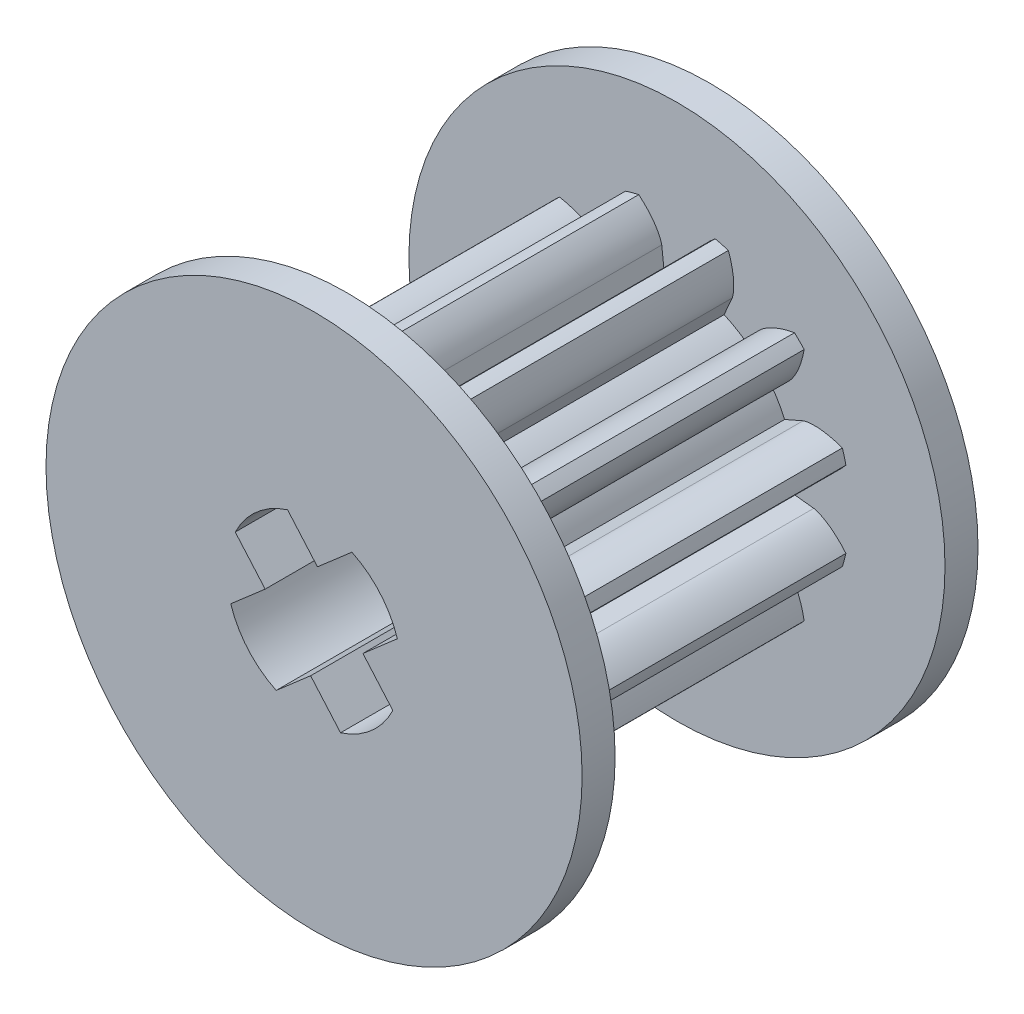
from build123d import *

# Parameters (mm, degrees)
SKETCH1_R               = 5.25
BOSS_EXTRUDE1_DEPTH     = 10
CUT_EXTRUDE3_DEPTH      = 13.454918707
CIRPATTERN1_COUNT       = 12
SKETCH6_R               = 8.125
BOSS_EXTRUDE2_DEPTH     = 1
CUT_EXTRUDE4_DEPTH      = 16.906956128
CUT_EXTRUDE4_DEPTH_BACK = 16.906956128


with BuildPart() as part:
    # Sketch1 → Boss-Extrude1 (new body)
    with BuildSketch(Plane.XY):
        Circle(SKETCH1_R)
    extrude(amount=BOSS_EXTRUDE1_DEPTH)

    # Sketch3 → Cut-Extrude3 (cut, through all)
    with BuildSketch(Plane.XY):
        with BuildLine():
            add(Edge.make_bspline(
                [(0.461546791, 4.146720396), (0.463953922, 4.163714882), (0.472985914, 4.201315534), (0.494149183, 4.266634462), (0.528558847, 4.349970943), (0.562413319, 4.416839281), (0.584280793, 4.45603904), (0.587367865, 4.461501876)],
                knots=[0, 0, 0, 0, 0.040008387, 0.090017613, 0.160030412, 0.250046806, 0.264674884, 0.264674884, 0.264674884, 0.264674884], degree=3))
            add(Edge.make_bspline(
                [(0.587367865, 4.461501876), (0.634900369, 4.545614692), (0.726044104, 4.679105945), (0.914750766, 4.902091874), (1.057206539, 5.036685302), (1.15776547, 5.120749859)],
                knots=[0.264674884, 0.264674884, 0.264674884, 0.264674884, 0.489907489, 0.63993471, 0.945583804, 0.945583804, 0.945583804, 0.945583804], degree=3))
            ThreePointArc((1.15776547, 5.120749859), (0, 5.25), (-1.15776547, 5.120749859))
            add(Edge.make_bspline(
                [(-0.587367865, 4.461501876), (-0.634900369, 4.545614692), (-0.726044104, 4.679105945), (-0.914750766, 4.902091874), (-1.057206539, 5.036685302), (-1.15776547, 5.120749859)],
                knots=[0.264674884, 0.264674884, 0.264674884, 0.264674884, 0.489907489, 0.63993471, 0.945583804, 0.945583804, 0.945583804, 0.945583804], degree=3))
            add(Edge.make_bspline(
                [(-0.461546791, 4.146720396), (-0.463953922, 4.163714882), (-0.472985914, 4.201315534), (-0.494149183, 4.266634462), (-0.528558847, 4.349970943), (-0.562413319, 4.416839281), (-0.584280793, 4.45603904), (-0.587367865, 4.461501876)],
                knots=[0, 0, 0, 0, 0.040008387, 0.090017613, 0.160030412, 0.250046806, 0.264674884, 0.264674884, 0.264674884, 0.264674884], degree=3))
            Line((-0.461546791, 4.146720396), (-0.394087114, 3.540635762))
            ThreePointArc((-0.394087114, 3.540635762), (0, 3.5625), (0.394087114, 3.540635762))
            Line((0.394087114, 3.540635762), (0.461546791, 4.146720396))
        make_face()
    cut_extrude3 = extrude(amount=CUT_EXTRUDE3_DEPTH, mode=Mode.SUBTRACT)

    # CirPattern1: Cut-Extrude3 ×12 about axis
    cirpattern1_axis = Axis((0, 0, 71.213492813), (0, 0, -1))
    for i in range(1, CIRPATTERN1_COUNT):
        add(cut_extrude3.rotate(cirpattern1_axis, i * 360 / CIRPATTERN1_COUNT), mode=Mode.SUBTRACT)

    # Sketch6 → Boss-Extrude2 (add)
    with BuildSketch(Plane.XY.offset(10)):
        Circle(SKETCH6_R)
    boss_extrude2 = extrude(amount=BOSS_EXTRUDE2_DEPTH)

    # Mirror1: Boss-Extrude2 across plane
    add(boss_extrude2.mirror(Plane.XY.offset(5)))

    # Sketch5 → Cut-Extrude4 (cut, two sides: drawn at the far end of the back side and taken through both)
    with BuildSketch(Plane.XY.offset(-CUT_EXTRUDE4_DEPTH_BACK)):
        with BuildLine():
            Line((1.147891735, 2.388481644), (0.103872104, 1.481286801))
            Line((0.103872104, 1.481286801), (-0.80332274, 2.525306432))
            ThreePointArc((-0.80332274, 2.525306432), (-1.738166165, 2.00031957), (-2.388481644, 1.147891735))
            Line((-2.388481644, 1.147891735), (-1.481286801, 0.103872104))
            Line((-1.481286801, 0.103872104), (-2.525306432, -0.80332274))
            ThreePointArc((-2.525306432, -0.80332274), (-2.00031957, -1.738166165), (-1.147891735, -2.388481644))
            Line((-1.147891735, -2.388481644), (-0.103872104, -1.481286801))
            Line((-0.103872104, -1.481286801), (0.80332274, -2.525306432))
            ThreePointArc((0.80332274, -2.525306432), (1.738166165, -2.00031957), (2.388481644, -1.147891735))
            Line((2.388481644, -1.147891735), (1.481286801, -0.103872104))
            Line((1.481286801, -0.103872104), (2.525306432, 0.80332274))
            ThreePointArc((2.525306432, 0.80332274), (2.00031957, 1.738166165), (1.147891735, 2.388481644))
        make_face()
    extrude(amount=CUT_EXTRUDE4_DEPTH + CUT_EXTRUDE4_DEPTH_BACK, mode=Mode.SUBTRACT)


solid = part.part
